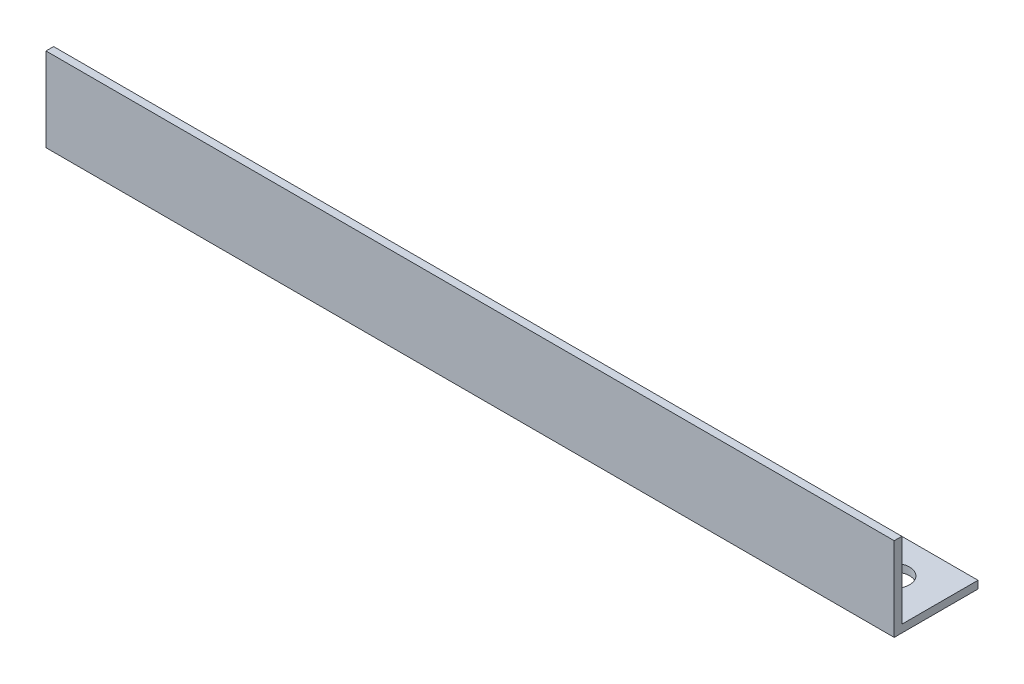
from build123d import *

# Parameters (mm, degrees)
EXTRUDE_1_DEPTH     = 334
SKETCH_2_R          = 6.05
CUT_EXTRUDE_1_DEPTH = 338.244718269


with BuildPart() as part:
    # Эскиз1 → Вытянуть-Тонкостенный1 (new body)
    with BuildSketch(Plane(origin=(0, 0, 0), x_dir=(0, 0, -1), z_dir=(1, 0, 0))):
        Polygon((0, 33), (0, 0), (33, 0), (33, 3), (3, 3), (3, 33), align=None)
    extrude(amount=EXTRUDE_1_DEPTH)

    # Эскиз2 → Вырез-Вытянуть1 (cut, through all)
    with BuildSketch(Plane.XZ):
        with Locations((316, -18)):
            Circle(SKETCH_2_R)
        with Locations((18, -18)):
            Circle(SKETCH_2_R)
    extrude(amount=-CUT_EXTRUDE_1_DEPTH, mode=Mode.SUBTRACT)


solid = part.part
